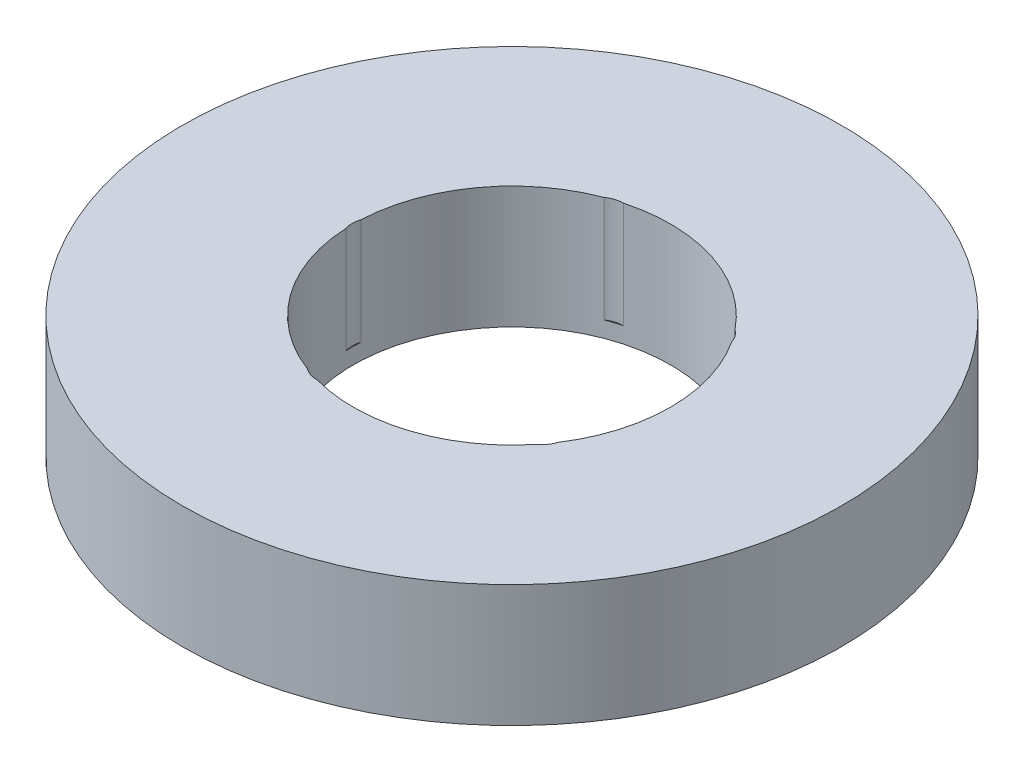
from build123d import *

# Parameters (mm, degrees)
SKETCH1_R           = 67.5
BOSS_EXTRUDE1_DEPTH = 25
SKETCH2_R           = 32.5
CUT_EXTRUDE1_DEPTH  = 99.67877178
SKETCH3_R           = 4.951144636
CUT_EXTRUDE2_DEPTH  = 21.737696999
CIRPATTERN1_COUNT   = 5


with BuildPart() as part:
    # Sketch1 → Boss-Extrude1 (new body)
    with BuildSketch(Plane(origin=(0, 0, 0), x_dir=(1, 0, 0), z_dir=(0, 1, 0))):
        Circle(SKETCH1_R)
    extrude(amount=BOSS_EXTRUDE1_DEPTH)

    # Sketch2 → Cut-Extrude1 (cut, through all)
    with BuildSketch(Plane(origin=(0, 0, 0), x_dir=(1, 0, 0), z_dir=(0, 1, 0))):
        Circle(SKETCH2_R)
    extrude(amount=CUT_EXTRUDE1_DEPTH, mode=Mode.SUBTRACT)

    # Sketch3 → Cut-Extrude2 (cut)
    with BuildSketch(Plane(origin=(0, 25, 0), x_dir=(1, 0, 0), z_dir=(0, 1, 0))):
        with Locations((-27.764813609, 0)):
            Circle(SKETCH3_R)
    cut_extrude2 = extrude(amount=-CUT_EXTRUDE2_DEPTH, mode=Mode.SUBTRACT)

    # CirPattern1: Cut-Extrude2 ×5 about axis
    cirpattern1_axis = Axis((0, 0, 0), (0, 1, 0))
    for i in range(1, CIRPATTERN1_COUNT):
        add(cut_extrude2.rotate(cirpattern1_axis, i * 360 / CIRPATTERN1_COUNT), mode=Mode.SUBTRACT)


solid = part.part
